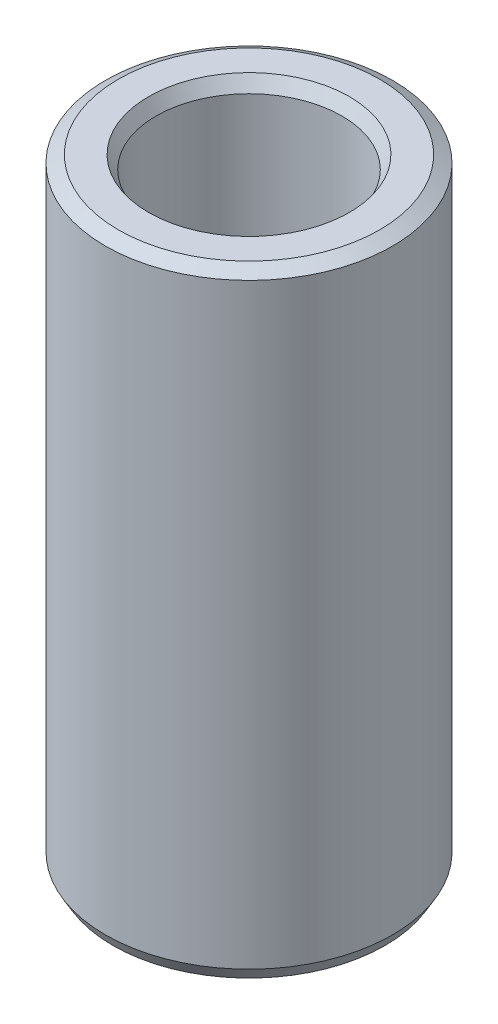
from build123d import *
from OCP.BRepFilletAPI import BRepFilletAPI_MakeChamfer

# Parameters (mm, degrees)
SKETCH1_R           = 27.5
BOSS_EXTRUDE1_DEPTH = 118.18304328
SKETCH2_R           = 17.79010355
CUT_EXTRUDE1_DEPTH  = 125.417569977
CHAMFER1_SIZE       = 1.437585153
CHAMFER1_SIZE2      = 2.489970525


with BuildPart() as part:
    # Sketch1 → Boss-Extrude1 (new body)
    with BuildSketch(Plane(origin=(0, 0, 0), x_dir=(1, 0, 0), z_dir=(0, 1, 0))):
        Circle(SKETCH1_R)
    extrude(amount=BOSS_EXTRUDE1_DEPTH)

    # Sketch2 → Cut-Extrude1 (cut, through all)
    with BuildSketch(Plane(origin=(0, 0, 0), x_dir=(1, 0, 0), z_dir=(0, 1, 0))):
        Circle(SKETCH2_R)
    extrude(amount=CUT_EXTRUDE1_DEPTH, mode=Mode.SUBTRACT)

    # Chamfer1: one chamfer whose edges measure the first distance from different faces: ONE call of the kernel's chamfer builder (chamfer() names one face for all edges)
    chamfer1_edges_1 = [part.edges().sort_by_distance(p)[0] for p in [
        (-17.79010355, 118.18304328, 0),
    ]]
    chamfer1_side_1 = [part.faces().sort_by_distance(p)[0] for p in [
        (-26.722182541, 118.18304328, 0),
    ]]
    chamfer1_edges_2 = [part.edges().sort_by_distance(p)[0] for p in [
        (-17.79010355, 0, 0),
    ]]
    chamfer1_side_2 = [part.faces().sort_by_distance(p)[0] for p in [
        (-17.79010355, 59.09152164, 0),
    ]]
    chamfer1_edges_3 = [part.edges().sort_by_distance(p)[0] for p in [
        (-27.5, 0, 0),
    ]]
    chamfer1_side_3 = [part.faces().sort_by_distance(p)[0] for p in [
        (-26.722182541, 0, 0),
    ]]
    chamfer1_edges_4 = [part.edges().sort_by_distance(p)[0] for p in [
        (-27.5, 118.18304328, 0),
    ]]
    chamfer1_side_4 = [part.faces().sort_by_distance(p)[0] for p in [
        (-27.5, 59.09152164, 0),
    ]]
    chamfer1 = BRepFilletAPI_MakeChamfer(part.part.solid().wrapped)
    for e in chamfer1_edges_1:
        chamfer1.Add(CHAMFER1_SIZE, CHAMFER1_SIZE2, e.wrapped, chamfer1_side_1[0].wrapped)  # the first distance lies on this face
    for e in chamfer1_edges_2:
        chamfer1.Add(CHAMFER1_SIZE, CHAMFER1_SIZE2, e.wrapped, chamfer1_side_2[0].wrapped)  # the first distance lies on this face
    for e in chamfer1_edges_3:
        chamfer1.Add(CHAMFER1_SIZE, CHAMFER1_SIZE2, e.wrapped, chamfer1_side_3[0].wrapped)  # the first distance lies on this face
    for e in chamfer1_edges_4:
        chamfer1.Add(CHAMFER1_SIZE, CHAMFER1_SIZE2, e.wrapped, chamfer1_side_4[0].wrapped)  # the first distance lies on this face
    add(Compound.cast(chamfer1.Shape()), mode=Mode.REPLACE)


solid = part.part
